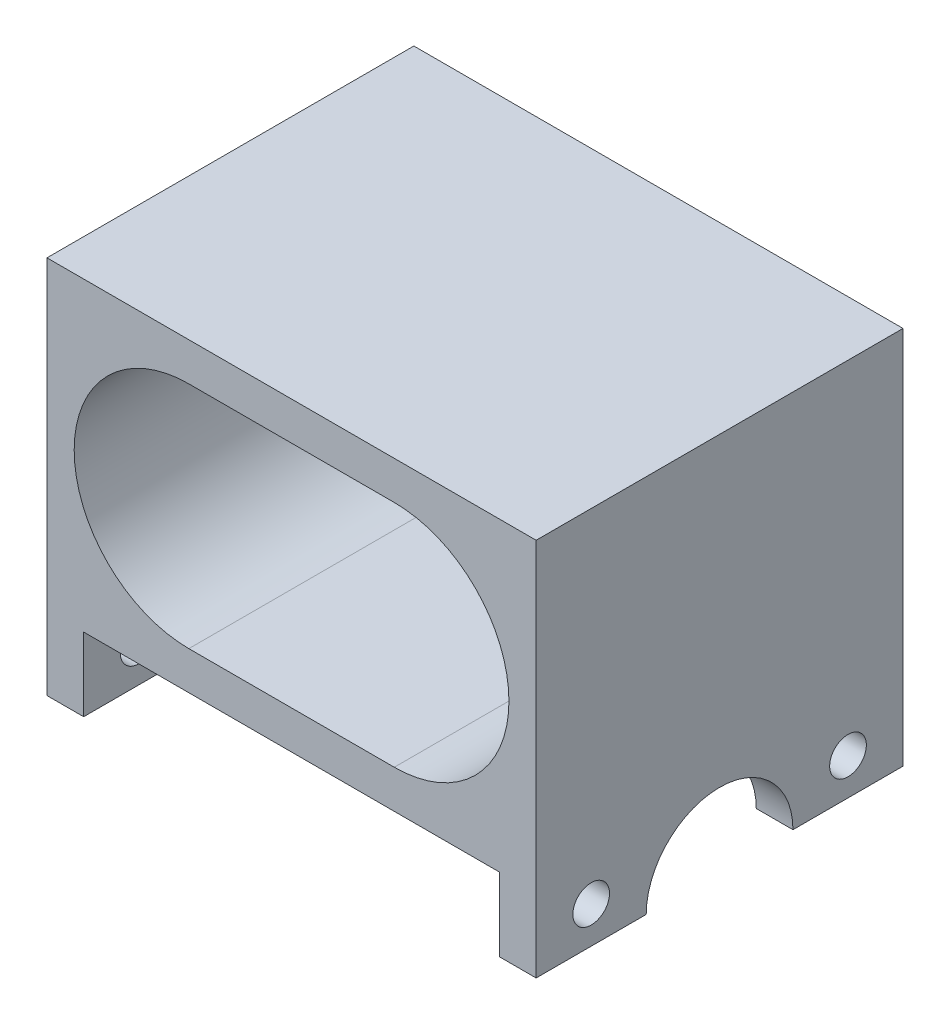
from build123d import *

# Parameters (mm, degrees)
BOSS_EXTRUDE1_DEPTH      = 15
BOSS_EXTRUDE1_DEPTH_BACK = 15
SKETCH1_W                = 40
SKETCH1_H                = 25
SKETCH2_W                = 9
SKETCH2_H                = 6
SKETCH2_R                = 1.5
BOSS_EXTRUDE2_DEPTH      = 3
MIRROR3_COPY_1_SKETCH_W  = 9
MIRROR3_COPY_1_SKETCH_H  = 6
MIRROR3_COPY_1_SKETCH_R  = 1.5
MIRROR3_COPY_1_DEPTH     = 3
FILLET1_R                = 6


with BuildPart() as part:
    # Sketch1 → Boss-Extrude1 (new, two sides: drawn at the far end of the back side and taken through both)
    with BuildSketch(Plane.XY.offset(-BOSS_EXTRUDE1_DEPTH_BACK)):
        Rectangle(SKETCH1_W, SKETCH1_H)
        with BuildLine():
            Line((-8.4, 9.375), (8.4, 9.375))
            ThreePointArc((8.4, 9.375), (17.775, 0), (8.4, -9.375))
            Line((8.4, -9.375), (-8.4, -9.375))
            ThreePointArc((-8.4, -9.375), (-17.775, 0), (-8.4, 9.375))
        make_face(mode=Mode.SUBTRACT)
    extrude(amount=BOSS_EXTRUDE1_DEPTH + BOSS_EXTRUDE1_DEPTH_BACK)

    # Sketch2 → Boss-Extrude2 (add)
    with BuildSketch(Plane(origin=(20, 0, 0), x_dir=(0, 0, -1), z_dir=(1, 0, 0))):
        with Locations((-10.5, -15.5)):
            Rectangle(SKETCH2_W, SKETCH2_H)
        with Locations((-10.5, -15.5)):
            Circle(SKETCH2_R, mode=Mode.SUBTRACT)
    boss_extrude2 = extrude(amount=-BOSS_EXTRUDE2_DEPTH)

    # Mirror1: Boss-Extrude2 across plane
    add(boss_extrude2.mirror(Plane.XY))

    # Mirror3: Boss-Extrude2 across plane
    add(boss_extrude2.mirror(Plane(origin=(0, 0, 0), x_dir=(0, 0, 1), z_dir=(1, 0, 0))))

    # Mirror3 copy 1 sketch → Mirror3 copy 1 (add)
    with BuildSketch(Plane.ZY.offset(20)):
        with Locations((-10.5, -15.5)):
            Rectangle(MIRROR3_COPY_1_SKETCH_W, MIRROR3_COPY_1_SKETCH_H)
        with Locations((-10.5, -15.5)):
            Circle(MIRROR3_COPY_1_SKETCH_R, mode=Mode.SUBTRACT)
    extrude(amount=-MIRROR3_COPY_1_DEPTH)

    # Fillet1
    fillet1_edges = [part.edges().sort_by_distance(p)[0] for p in [
        (-18.5, -12.5, -6),
        (-18.5, -12.5, 6),
        (18.5, -12.5, -6),
        (18.5, -12.5, 6),
    ]]
    fillet(fillet1_edges, radius=FILLET1_R - 0.0001)  # a hair under: the kernel refuses the full size


solid = part.part
